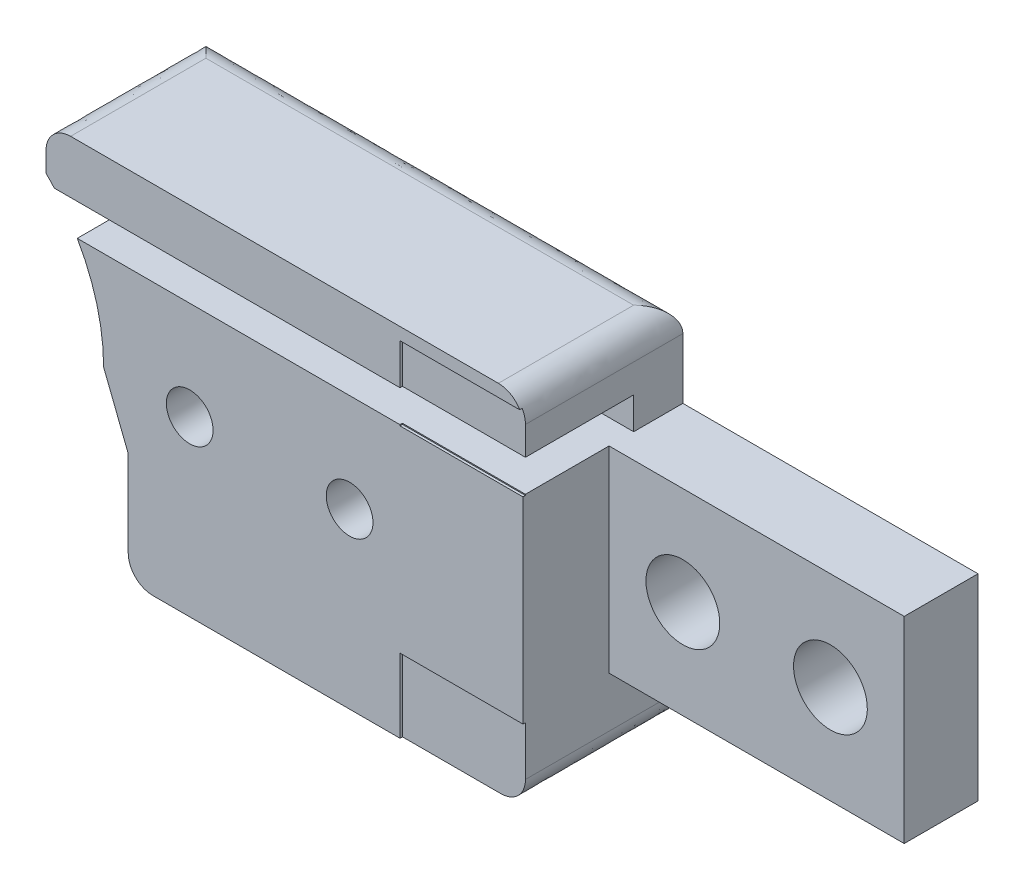
from build123d import *

# Parameters (mm, degrees)
BOSS_EXTRUDE1_DEPTH      = 2
BOSS_EXTRUDE6_DEPTH      = 4.5
CUT_EXTRUDE6_DEPTH       = 4.5
BOSS_EXTRUDE14_DEPTH     = 2.3
SKETCH32_R               = 3
CUT_EXTRUDE7_DEPTH       = 2.3
SKETCH33_W               = 12.393398282201806
SKETCH33_H               = 2.000000000000001
BOSS_EXTRUDE15_DEPTH     = 1.2
CUT_EXTRUDE8_DEPTH       = 2.4
SKETCH43_R               = 2.5000000000000004
SKETCH43_R_2             = 2.4999999999999982
BOSS_EXTRUDE17_DEPTH     = 1.2
CUT_EXTRUDE11_DEPTH      = 29.420773915365164
CUT_EXTRUDE11_DEPTH_BACK = 29.420773915365164
SKETCH44_R               = 0.9499999999999992
SKETCH44_R_2             = 0.9500000000000008
SKETCH49_R               = 0.7500000000000021
CUT_EXTRUDE13_DEPTH      = 3
FILLET1_R                = 1.5
FILLET3_START            = -1
FILLET3_DEPTH            = 8
FILLET3_START_2          = 5
FILLET3_2_DEPTH          = 21
FILLET3_3_DEPTH          = 8
SKETCH45_R               = 1.9999999999999996
SKETCH45_R_2             = 2.000000000000003
CUT_EXTRUDE15_DEPTH      = 4
FILLET4_R                = 2
BOSS_EXTRUDE18_DEPTH     = 12
SKETCH52_R               = 1.500000000000004
SKETCH52_R_2             = 1.5000000000000007
CUT_EXTRUDE16_DEPTH      = 12


with BuildPart() as part:
    # Sketch3 → Boss-Extrude1 (new body)
    with BuildSketch(Plane.XY):
        with BuildLine():
            Line((8.000000000000002, 0), (8.999999999999995, -2.5431457505076205))
            Line((8.999999999999995, -2.5431457505076205), (8.999999999999995, -7.043145750507605))
            Line((8.999999999999995, -7.043145750507605), (21.50000000000004, -7.043145750507604))
            Line((21.50000000000004, -7.043145750507604), (25.05025253169418, -7.043145750507604))
            Line((25.05025253169418, -7.043145750507604), (25.050252531694177, 7.456854249492383))
            Line((25.050252531694177, 7.456854249492383), (5.656854249492373, 7.456854249492379))
            Line((5.656854249492373, 7.456854249492379), (5.656854249492376, 5.656854249492382))
            ThreePointArc((5.656854249492376, 5.656854249492382), (7.391036260090296, 3.061467458920721), (8.000000000000002, 0))
        make_face()
    extrude(amount=BOSS_EXTRUDE1_DEPTH)

    # Sketch22 → Boss-Extrude6 (add)
    with BuildSketch(Plane.XY.offset(2)):
        with BuildLine():
            Line((5.656854249492378, 7.456854249492383), (21.500000000000025, 7.456854249492383))
            Line((21.500000000000025, 7.456854249492383), (25.050252531694177, 7.456854249492383))
            Line((25.050252531694177, 7.456854249492383), (25.05025253169418, -7.043145750507604))
            Line((25.05025253169418, -7.043145750507604), (8.999999999999995, -7.043145750507605))
            Line((8.999999999999995, -7.043145750507605), (8.999999999999995, -2.5431457505076205))
            Line((8.999999999999995, -2.5431457505076205), (7.999999999999998, 0))
            ThreePointArc((7.999999999999998, 0), (7.391036260090291, 3.061467458920719), (5.656854249492376, 5.656854249492382))
            Line((5.656854249492376, 5.656854249492382), (5.656854249492378, 7.456854249492383))
        make_face()
    extrude(amount=BOSS_EXTRUDE6_DEPTH)

    # Sketch26 → Cut-Extrude6 (cut)
    with BuildSketch(Plane.XY.offset(2)):
        Polygon((18.098080447707712, 5.299999999999999), (2.5300524575164793, 5.299999999999999), (2.5300524575164793, 4), (18.098080447707712, 4), (25.05025253169419, 4.000000000000001), (25.05025253169419, 5.299999999999999), align=None)
    extrude(amount=CUT_EXTRUDE6_DEPTH, mode=Mode.SUBTRACT)


with BuildPart() as body_2:
    # Sketch31 → Boss-Extrude14 (new body)
    with BuildSketch(Plane.XY.offset(6.5)):
        with BuildLine():
            Line((2.4326880657739025, 5.656854247099344), (0.00016454221484158, 5.656854247099344))
            ThreePointArc((0.00016454221484158, 5.656854247099344), (-5.656854248894122, 8.227110743131e-05), (0, -5.656854249492382))
            Line((0, -5.656854249492382), (9.000000000000004, -5.656854249492382))
            Line((9.000000000000004, -5.656854249492382), (8.999999999999995, -7.043145750507605))
            Line((8.999999999999995, -7.043145750507605), (8.999999999999995, -8.543145750507605))
            Line((8.999999999999995, -8.543145750507605), (21.50000000000004, -8.543145750507605))
            Line((21.50000000000004, -8.543145750507605), (21.50000000000004, -7.043145750507605))
            Line((21.50000000000004, -7.043145750507605), (25.05025253169418, -7.043145750507604))
            Line((25.05025253169418, -7.043145750507604), (25.05025253169418, 8.956854249492379))
            Line((25.05025253169418, 8.956854249492379), (5.656854249492376, 8.956854249492379))
            Line((5.656854249492376, 8.956854249492379), (5.656854249492378, 7.456854249492383))
            Line((5.656854249492378, 7.456854249492383), (5.656854249492376, 5.613708498984764))
            Line((5.656854249492376, 5.613708498984764), (2.4326880657739025, 5.656854247099344))
        make_face()
    extrude(amount=BOSS_EXTRUDE14_DEPTH)

    # Sketch32 → Cut-Extrude7 (cut)
    with BuildSketch(Plane.XY.offset(8.799999999999999)):
        Circle(SKETCH32_R)
    extrude(amount=-CUT_EXTRUDE7_DEPTH, mode=Mode.SUBTRACT)

    # Sketch33 → Boss-Extrude15 (add)
    with BuildSketch(Plane.XY.offset(8.799999999999999)):
        with Locations((11.853553390593277, 7.956854249492379)):
            Rectangle(SKETCH33_W, SKETCH33_H)
        Polygon((9.000000000000004, -7.043145750507606), (9.000000000000004, -8.543145750507605), (18.05025253169418, -8.543145750507605), (18.05025253169418, -7.0431457505076045), align=None)
        with BuildLine():
            Line((7.000000000000003, -4.156854249492383), (18.05025253169419, -4.156854249492383))
            Line((18.05025253169419, -4.156854249492383), (18.05025253169419, -2.1568542494923824))
            Line((18.05025253169419, -2.1568542494923824), (7.000000000000003, -2.1568542494923832))
            ThreePointArc((7.000000000000003, -2.1568542494923832), (6.000000000000003, -3.1568542494923832), (7.000000000000003, -4.156854249492383))
        make_face()
        with BuildLine():
            Line((18.05025253169419, 2.172006245196199), (7.000000000000003, 2.172006245196201))
            ThreePointArc((7.000000000000003, 2.172006245196201), (6.0000000000000036, 3.1720062451962), (7.000000000000003, 4.172006245196199))
            Line((7.000000000000003, 4.172006245196199), (18.05025253169419, 4.172006245196199))
            Line((18.05025253169419, 4.172006245196199), (18.05025253169419, 2.172006245196199))
        make_face()
    extrude(amount=BOSS_EXTRUDE15_DEPTH)


with BuildPart() as cut_extrude8_tool:
    # Sketch35 → Cut-Extrude8 (new body)
    with BuildSketch(Plane.XY.offset(8.799999999999999)):
        Polygon((25.05025253169418, 3.956854249492379), (25.05025253169418, 6.9568542494923795), (20.05025253169418, 6.956854249492378), (20.05025253169418, 3.9568542494923773), align=None)
        Polygon((25.05025253169418, -7.043145750507604), (20.05025253169419, -7.0431457505076045), (20.05025253169419, -4.043145750507604), (25.05025253169418, -4.043145750507604), align=None)
    extrude(amount=-CUT_EXTRUDE8_DEPTH)


with BuildPart() as part_1:
    add(part.part)

    # Cut-Extrude8: cut by cut_extrude8_tool
    add(cut_extrude8_tool.part, mode=Mode.SUBTRACT)


with BuildPart() as body_2_1:
    add(body_2.part)

    # Cut-Extrude8: cut by cut_extrude8_tool
    add(cut_extrude8_tool.part, mode=Mode.SUBTRACT)

    # Sketch43 → Boss-Extrude17 (add)
    with BuildSketch(Plane.XY.offset(8.799999999999999)):
        with Locations((11.500000000000004, 0)):
            Circle(SKETCH43_R)
        with Locations((18.000000000000004, 0)):
            Circle(SKETCH43_R_2)
    extrude(amount=BOSS_EXTRUDE17_DEPTH)


with BuildPart() as cut_extrude11_tool:
    # Sketch44 → Cut-Extrude11 (new, two sides: drawn at the far end of the back side and taken through both)
    with BuildSketch(Plane.XY.offset(9.999999999999998).offset(-CUT_EXTRUDE11_DEPTH_BACK)):
        with Locations((11.500000000000004, 0)):
            Circle(SKETCH44_R)
        with Locations((18.000000000000004, 0)):
            Circle(SKETCH44_R_2)
    extrude(amount=CUT_EXTRUDE11_DEPTH + CUT_EXTRUDE11_DEPTH_BACK)


with BuildPart() as part_2:
    add(part_1.part)

    # Cut-Extrude11: cut by cut_extrude11_tool
    add(cut_extrude11_tool.part, mode=Mode.SUBTRACT)

    # Fillet3: read off the stored shape, not the designer's step
    # Fillet3 outline → Fillet3 (cut)
    with BuildSketch(Plane.XY.offset(FILLET3_START)):
        with BuildLine():
            Line((9, -7.043145751), (10, -7.043145751))
            add(Edge.make_bspline(
                [(10, -7.043145751), (8.99999999999999, -7.043145750507609), (9, -6.043145751)],
                knots=[0, 0, 0, 1, 1, 1], degree=2, weights=[1, 0.7071067811865481, 1]))
            Line((9, -6.043145751), (9, -7.043145751))
        make_face()
        with BuildLine():
            Line((5.656854249, 7.456854249), (5.656854249, 6.456854249))
            add(Edge.make_bspline(
                [(5.656854249, 6.456854249), (5.656854249492369, 7.4568542494923795), (6.656854249, 7.456854249)],
                knots=[0, 0, 0, 1, 1, 1], degree=2, weights=[1, 0.707106781186547, 1]))
            Line((6.656854249, 7.456854249), (5.656854249, 7.456854249))
        make_face()
    extrude(amount=FILLET3_DEPTH, mode=Mode.SUBTRACT)

    # Fillet3 2 outline → Fillet3 2 (cut)
    with BuildSketch(Plane.YZ.offset(FILLET3_START_2)):
        with BuildLine():
            Line((-7.043145751, 0), (-6.043145751, 0))
            add(Edge.make_bspline(
                [(-6.043145751, 0), (-7.0431457505076045, 0), (-7.043145751, 1)],
                knots=[0, 0, 0, 1, 1, 1], degree=2, weights=[1, 0.707106781186548, 1]))
            Line((-7.043145751, 1), (-7.043145751, 0))
        make_face()
        with BuildLine():
            add(Edge.make_bspline(
                [(6.456854249, 0), (7.456854249492381, 0), (7.456854249, 1)],
                knots=[0, 0, 0, 1, 1, 1], degree=2, weights=[1, 0.707106781186548, 1]))
            Line((6.456854249, 0), (7.456854249, 0))
            Line((7.456854249, 0), (7.456854249, 1))
        make_face()
    extrude(amount=FILLET3_2_DEPTH, mode=Mode.SUBTRACT)

    # Fillet3 3 outline → Fillet3 3 (cut)
    with BuildSketch(Plane.XY.offset(FILLET3_START)):
        with BuildLine():
            Line((25.050252532, -7.043145751), (25.050252532, -6.043145751))
            add(Edge.make_bspline(
                [(25.050252532, -6.043145751), (25.050252531694195, -7.0431457505076045), (24.050252532, -7.043145751)],
                knots=[0, 0, 0, 1, 1, 1], degree=2, weights=[1, 0.707106781186548, 1]))
            Line((24.050252532, -7.043145751), (25.050252532, -7.043145751))
        make_face()
        with BuildLine():
            Line((25.050252532, 6.456854249), (25.050252532, 7.456854249))
            Line((25.050252532, 7.456854249), (24.050252532, 7.456854249))
            add(Edge.make_bspline(
                [(24.050252532, 7.456854249), (24.23662286224227, 7.456854249492371), (24.442904569552457, 7.413222711328381), (24.646119560607424, 7.308816022097408), (24.808964717093836, 7.142726196138974), (24.971827345010716, 6.860639849810825), (25.01301948040526, 6.758429238057051), (25.038618001980854, 6.6546327736033515), (25.050252531694174, 6.553326631418876), (25.050252532, 6.456854249)],
                knots=[0, 0, 0, 0, 0, 0, 0.6589186227127712, 0.6589186227127712, 0.6589186227127712, 0.6589186227127712, 1.0000000000000395, 1.0000000000000395, 1.0000000000000395, 1.0000000000000395, 1.0000000000000395, 1.0000000000000395], degree=5, weights=[1, 1.0000000000000024, 0.9950915544751191, 0.9930584097693568, 0.9999999999999981, 1.0000000000000009, 0.9997935626898684, 0.9999244387002607, 0.9999999999999992, 1]))
        make_face()
    extrude(amount=FILLET3_3_DEPTH, mode=Mode.SUBTRACT)

    # Sketch45 → Cut-Extrude15 (cut)
    with BuildSketch(Plane(origin=(0, 0, 0), x_dir=(-1, 0, 0), z_dir=(0, 0, -1))):
        with Locations((-11.500000000000004, 0)):
            Circle(SKETCH45_R)
        with Locations((-18.000000000000004, 0)):
            Circle(SKETCH45_R_2)
    extrude(amount=-CUT_EXTRUDE15_DEPTH, mode=Mode.SUBTRACT)

    # Sketch51 → Boss-Extrude18 (add)
    with BuildSketch(Plane(origin=(25.05025253169418, 5.99e-15, 0), x_dir=(0, 0, -1), z_dir=(1, 2.4e-16, 0))):
        Polygon((-9.5e-16, 3.9999999999999947), (3e-17, -4.000000000000005), (-3, -4.000000000000005), (-3.000000000000001, 3.9999999999999942), align=None)
    extrude(amount=BOSS_EXTRUDE18_DEPTH)

    # Sketch52 → Cut-Extrude16 (cut)
    with BuildSketch(Plane(origin=(0, 0, 0), x_dir=(-1, 0, 0), z_dir=(0, 0, -1))):
        with Locations((-34.05025253169418, 3.47e-15)):
            Circle(SKETCH52_R)
        with Locations((-28.05025253169418, 3.9e-15)):
            Circle(SKETCH52_R_2)
    extrude(amount=-CUT_EXTRUDE16_DEPTH, mode=Mode.SUBTRACT)


with BuildPart() as body_2_2:
    add(body_2_1.part)

    # Cut-Extrude11: cut by cut_extrude11_tool
    add(cut_extrude11_tool.part, mode=Mode.SUBTRACT)

    # Sketch49 → Cut-Extrude13 (cut, along a direction that is not the sketch's normal)
    with BuildSketch(Plane.XZ.offset(-6.956854249492379)):
        with Locations((16.05025253169419, 9.999999999999998)):
            Circle(SKETCH49_R)
    extrude(amount=-CUT_EXTRUDE13_DEPTH, dir=(0.6858421465414155, -0.7277503349552398, 0), mode=Mode.SUBTRACT)

    # Fillet1
    fillet1_edges = [body_2_2.edges().sort_by_distance(p)[0] for p in [
        (15.353553390593278, 8.956854249492379, 6.5),
        (15.250000000000018, -8.543145750507605, 6.5),
    ]]
    fillet(fillet1_edges, radius=FILLET1_R)

    # Fillet4
    fillet4_edges = [body_2_2.edges().sort_by_distance(p)[0] for p in [
        (20.05025253169418, 5.456854249492378, 8.799999999999999),
        (20.05025253169419, -5.543145750507604, 8.799999999999999),
    ]]
    fillet(fillet4_edges, radius=FILLET4_R - 0.0001)  # a hair under: the kernel refuses the full size


solid = part_2.part
